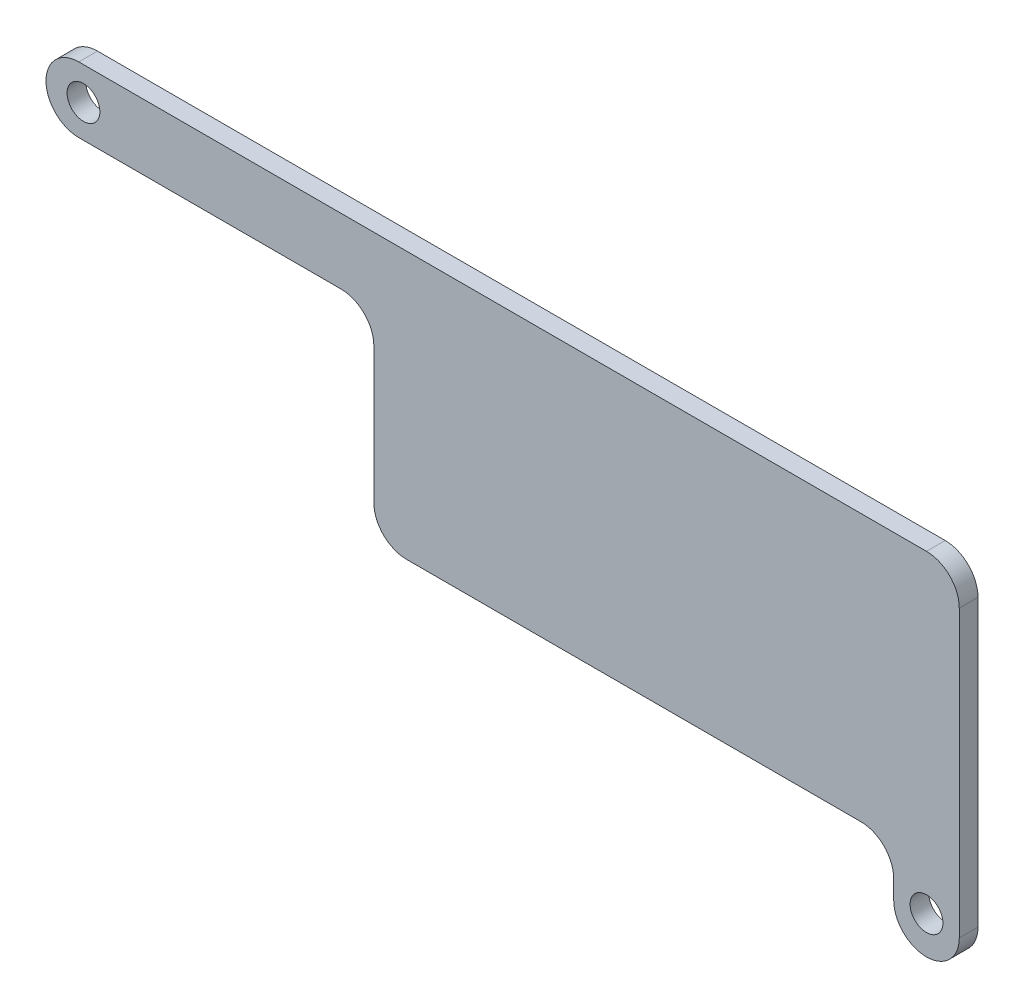
from build123d import *

# Parameters (mm, degrees)
ESQUISSE1_R        = 1.75
BOSS_EXTRU_1_DEPTH = 2
CONG_1_R           = 3.5


with BuildPart() as part:
    # Esquisse1 → Boss.-Extru.1 (new body)
    with BuildSketch(Plane.XY):
        Polygon((-64.5, 9), (-29.5, 9), (-29.5, -12.5), (26, -12.5), (26, -21.5), (33, -21.5), (33, -12.5), (33, 16), (-29.5, 16), (-64.5, 16), align=None)
        with Locations((29.5, -17.5)):
            Circle(ESQUISSE1_R, mode=Mode.SUBTRACT)
        with Locations((-60.5, 12.5)):
            Circle(ESQUISSE1_R, mode=Mode.SUBTRACT)
    extrude(amount=BOSS_EXTRU_1_DEPTH)

    # Congé1
    cong_1_edges = [part.edges().sort_by_distance(p)[0] for p in [
        (33, 16, 1),
        (26, -12.5, 1),
        (-29.5, -12.5, 1),
        (-29.5, 9, 1),
        (-64.5, 16, 1),
        (-64.5, 9, 1),
        (26, -21.5, 1),
        (33, -21.5, 1),
    ]]
    fillet(cong_1_edges, radius=CONG_1_R - 0.0001)  # a hair under: the kernel refuses the full size


solid = part.part
